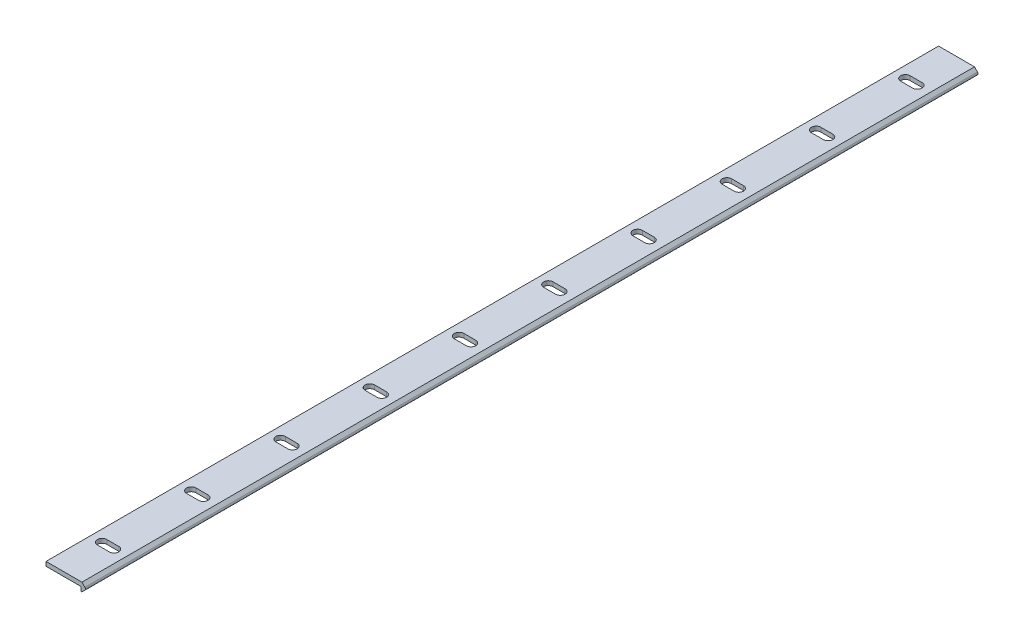
from build123d import *

# Parameters (mm, degrees)
BOSS_EXTRUDE1_DEPTH = 500
CUT_EXTRUDE1_DEPTH  = 2.375
LPATTERN1_COUNT     = 10
LPATTERN1_PITCH     = 50
FILLET1_R           = 1


with BuildPart() as part:
    # Sketch1 → Boss-Extrude1 (new body)
    with BuildSketch(Plane.XY):
        Polygon((19.5291, 2.375), (0, 2.375), (0, 4.75), (19.5291, 4.75), (20.122, 4.75), (22.497, 2.375), (20.122, 0), (19.5291, 0), align=None)
    extrude(amount=BOSS_EXTRUDE1_DEPTH)

    # Sketch2 → Cut-Extrude1 (cut)
    with BuildSketch(Plane(origin=(0, 4.75, 0), x_dir=(1, 0, 0), z_dir=(0, 1, 0))):
        with BuildLine():
            Line((13.1087, -22.35), (6.4087, -22.35))
            ThreePointArc((6.4087, -22.35), (3.7587, -25), (6.4087, -27.65))
            Line((6.4087, -27.65), (13.1087, -27.65))
            ThreePointArc((13.1087, -27.65), (15.7587, -25), (13.1087, -22.35))
        make_face()
    cut_extrude1 = extrude(amount=-CUT_EXTRUDE1_DEPTH, mode=Mode.SUBTRACT)

    # LPattern1: Cut-Extrude1 ×10
    with Locations(*[(0, 0, i * LPATTERN1_PITCH) for i in range(1, LPATTERN1_COUNT)]):
        add(cut_extrude1, mode=Mode.SUBTRACT)

    # Fillet1
    fillet1_edges = [part.edges().sort_by_distance(p)[0] for p in [
        (22.497, 2.375, 250),
    ]]
    fillet(fillet1_edges, radius=FILLET1_R)


solid = part.part
